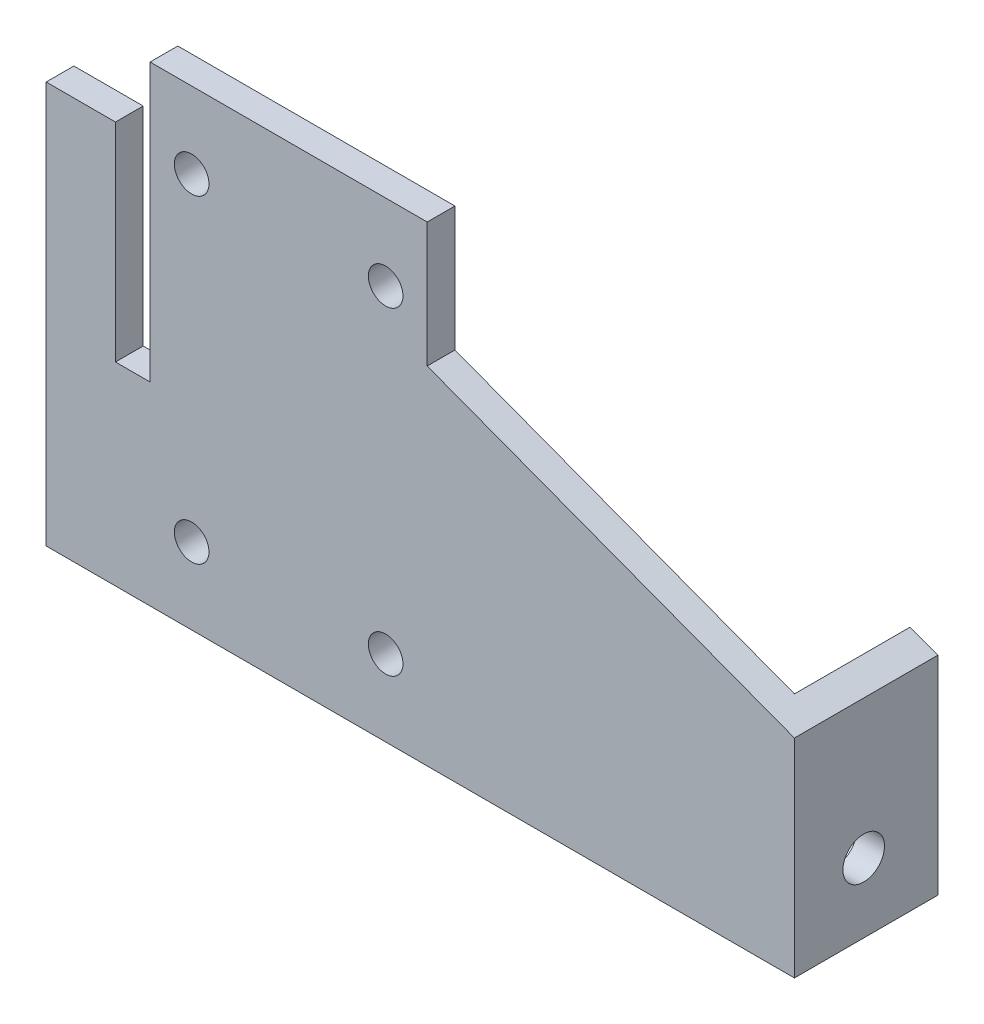
from build123d import *

# Parameters (mm, degrees)
SKETCH_1_R          = 2.5
EXTRUDE_1_DEPTH     = 4
EXTRUDE_2_DEPTH     = 20.7
SKETCH_3_R          = 3
CUT_EXTRUDE_1_DEPTH = 6.7
CUT_EXTRUDE_2_DEPTH = 10


with BuildPart() as part:
    # Эскиз1 → Бобышка-Вытянуть1 (new body)
    with BuildSketch(Plane.XY):
        Polygon((0, 0), (108, 0), (108, 30), (55, 50), (55, 68), (0, 68), align=None)
        with Locations((21, 57)):
            Circle(SKETCH_1_R, mode=Mode.SUBTRACT)
        with Locations((49, 57)):
            Circle(SKETCH_1_R, mode=Mode.SUBTRACT)
        with Locations((21, 11)):
            Circle(SKETCH_1_R, mode=Mode.SUBTRACT)
        with Locations((49, 11)):
            Circle(SKETCH_1_R, mode=Mode.SUBTRACT)
    extrude(amount=EXTRUDE_1_DEPTH)

    # Эскиз2 → Бобышка-Вытянуть2 (add)
    with BuildSketch(Plane.XY.offset(4)):
        Polygon((108, 0), (104, 0), (104, 31.509433962), (108, 30), align=None)
    extrude(amount=-EXTRUDE_2_DEPTH)

    # Эскиз3 → Вырез-Вытянуть1 (cut)
    with BuildSketch(Plane(origin=(108, 0, 0), x_dir=(0, 0, -1), z_dir=(1, 0, 0))):
        with Locations((6, 10)):
            Circle(SKETCH_3_R)
    extrude(amount=-CUT_EXTRUDE_1_DEPTH, mode=Mode.SUBTRACT)

    # Эскиз4 → Вырез-Вытянуть2 (cut)
    with BuildSketch(Plane(origin=(0, 0, 0), x_dir=(-1, 0, 0), z_dir=(0, 0, -1))):
        Polygon((0, 68), (-15, 68), (-15, 48), (-15, 28), (-10, 28), (-10, 58), (0, 58), align=None)
    extrude(amount=-CUT_EXTRUDE_2_DEPTH, mode=Mode.SUBTRACT)


solid = part.part
